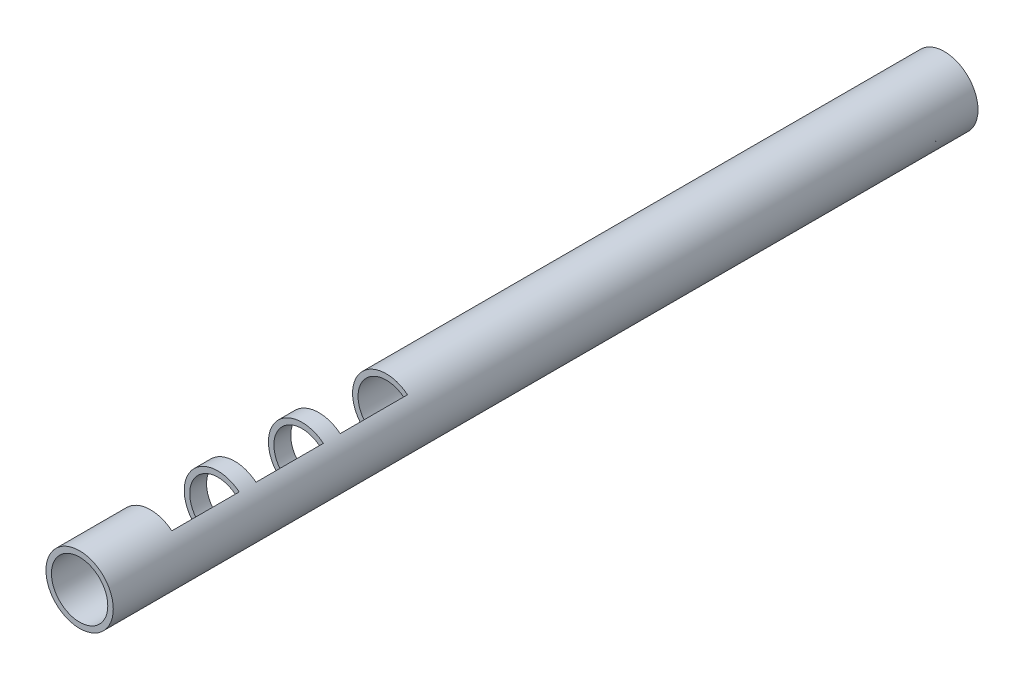
from build123d import *

# Parameters (mm, degrees)
SURFACE_EXTRUDE1_1_DEPTH   = 1.866
SURFACE_TRIM1_TOOL_2_BACK  = 3.327
SURFACE_TRIM1_TOOL_2_DEPTH = 6.654
THICKEN2_T1                = 0.101386
LPATTERN3_COUNT            = 3
LPATTERN3_PITCH            = 1.555
BOSS_EXTRUDE1_DEPTH        = 10
BOSS_EXTRUDE2_DEPTH        = 1
SKETCH7_R                  = 0.2
CUT_EXTRUDE2_DEPTH         = 11.038613849


with BuildPart() as body_1:
    # Surface-Extrude1: a surface, the sketch's curves swept straight by 1.866 mm
    with BuildLine(Plane.XY, mode=Mode.PRIVATE) as surface_extrude1_1_path:
        ThreePointArc((0.622, 0), (0, 0.622), (-0.622, 0))
    surface_extrude1_1 = Shell.extrude(surface_extrude1_1_path.wire(), (0 * SURFACE_EXTRUDE1_1_DEPTH, 0 * SURFACE_EXTRUDE1_1_DEPTH, 1 * SURFACE_EXTRUDE1_1_DEPTH))
    # Surface-Trim1 tool: a surface, the sketch's curves swept straight by 6.654 mm
    with BuildLine(Plane(origin=(0, 0, 0), x_dir=(1, 0, 0), z_dir=(0, 1, 0)).offset(-SURFACE_TRIM1_TOOL_2_BACK), mode=Mode.PRIVATE) as surface_trim1_tool_2_path:
        Line((-0.622, -1.555), (0.3932, -1.555))
        Line((0.3932, -1.555), (0.3932, -0.311))
        Line((0.3932, -0.311), (-0.622, -0.311))
    surface_trim1_tool_2 = Shell.extrude(surface_trim1_tool_2_path.wire(), (0 * SURFACE_TRIM1_TOOL_2_DEPTH, 1 * SURFACE_TRIM1_TOOL_2_DEPTH, 0 * SURFACE_TRIM1_TOOL_2_DEPTH))
    # Surface-Trim1: the surface trimmed, the side behind the tool kept
    surface_trim1_3 = split(surface_extrude1_1.faces()[0], bisect_by=surface_trim1_tool_2, keep=Keep.BOTTOM).faces()[0]
    add(Solid.thicken(surface_trim1_3, THICKEN2_T1))


with BuildPart() as lpattern3_1:
    # LPattern3: pattern copy
    add(body_1.part.moved(Location(Vector(0, 0, 1) * (1 * LPATTERN3_PITCH))))


with BuildPart() as lpattern3_2:
    # LPattern3: pattern copy
    add(body_1.part.moved(Location(Vector(0, 0, 1) * (2 * LPATTERN3_PITCH))))


with BuildPart() as body_1_1:
    add(body_1.part)

    # Combine1: read off the stored shape, not the designer's step
    # Combine1: union LPattern3_2, LPattern3_1
    add(lpattern3_2.part)
    add(lpattern3_1.part)

    # Sketch5 → Boss-Extrude1 (add)
    with BuildSketch(Plane(origin=(0, 0, 0), x_dir=(-1, 0, 0), z_dir=(0, 0, -1))):
        with BuildLine():
            Line((-0.622, 0), (-0.520614, 0))
            ThreePointArc((-0.520614, 0), (0, 0.520614), (0.520614, 0))
            Line((0.520614, 0), (0.622, 0))
            ThreePointArc((0.622, 0), (0, 0.622), (-0.622, 0))
        make_face()
    extrude(amount=BOSS_EXTRUDE1_DEPTH)

    # Sketch6 → Boss-Extrude2 (add)
    with BuildSketch(Plane.XY.offset(4.976)):
        with BuildLine():
            Line((-0.622, 0), (-0.520614, 0))
            ThreePointArc((-0.520614, 0), (0, 0.520614), (0.520614, 0))
            Line((0.520614, 0), (0.622, 0))
            ThreePointArc((0.622, 0), (0, 0.622), (-0.622, 0))
        make_face()
    extrude(amount=BOSS_EXTRUDE2_DEPTH)

    # Sketch7 → Cut-Extrude2 (cut, through all)
    with BuildSketch(Plane(origin=(0, 0, 0), x_dir=(0, 0, -1), z_dir=(1, 0, 0))):
        with Locations((-5.165, 0)):
            Circle(SKETCH7_R)
    extrude(amount=-CUT_EXTRUDE2_DEPTH, mode=Mode.SUBTRACT)

    # Mirror1: body 1 across face


with BuildPart() as body_1_2:
    add(body_1_1.part)
    add(body_1_1.part.mirror(Plane(origin=(0.571307, 0, -2.012), x_dir=(0, 0, 1), z_dir=(0, -1, 0))))


solid = body_1_2.part
